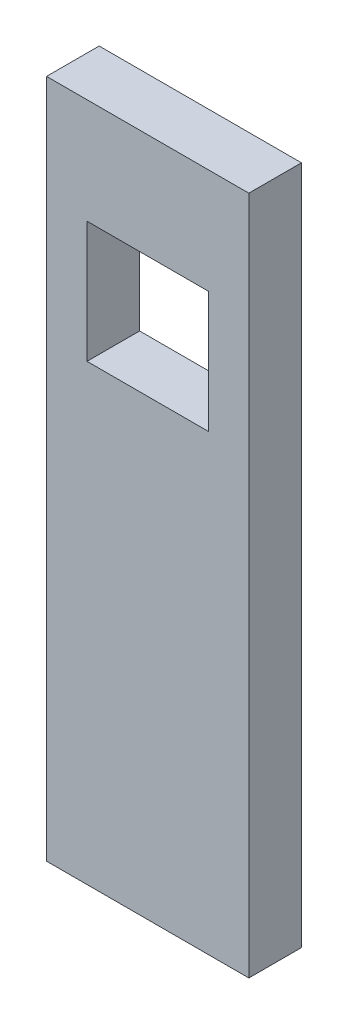
from build123d import *

# Parameters (mm, degrees)
SKETCH1_W           = 12
SKETCH1_H           = 12
BOSS_EXTRUDE1_DEPTH = 2.6


with BuildPart() as part:
    # Sketch1 → Boss-Extrude1 (new, symmetric)
    with BuildSketch(Plane.XY):
        Polygon((0, 67.2), (0, 44.8), (0, 39.6), (0, 27.6), (0, 22.4), (0, 0), (20, 0), (20, 22.4), (20, 27.6), (20, 39.6), (20, 44.8), (20, 67.2), align=None)
        with Locations((10, 50.8)):
            Rectangle(SKETCH1_W, SKETCH1_H, mode=Mode.SUBTRACT)
    extrude(amount=BOSS_EXTRUDE1_DEPTH, both=True)


solid = part.part
